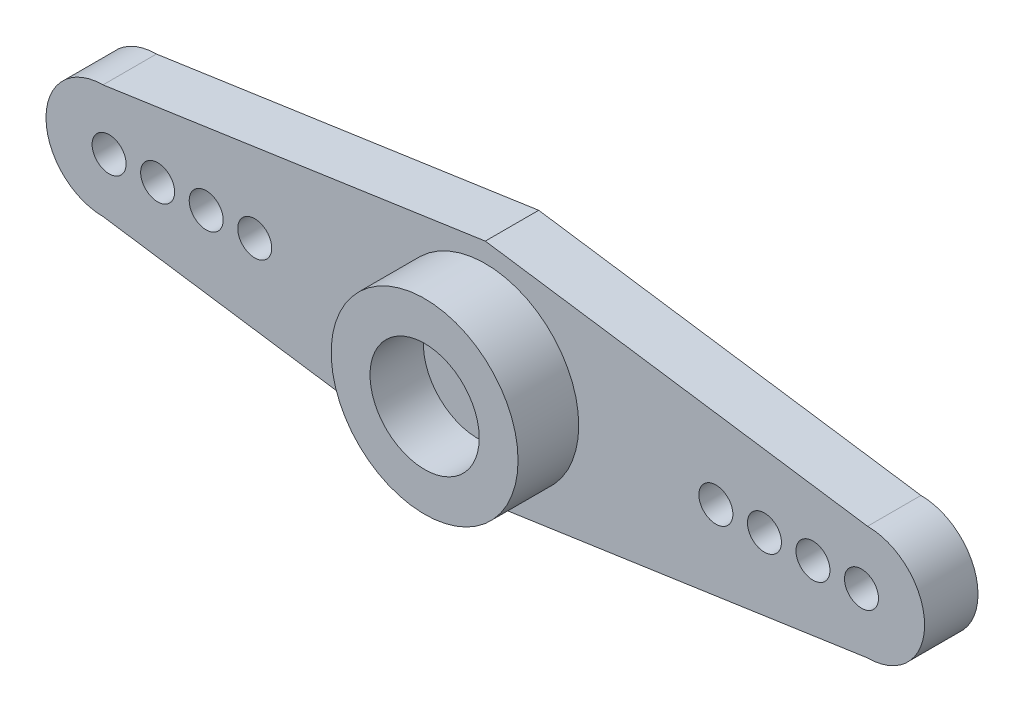
from build123d import *

# Parameters (mm, degrees)
SKETCH1_W         = 45.974
SKETCH1_H         = 11.811
EXTRUDE1_DEPTH    = 5.969
SKETCH2_OUTSIDE_W = 57.542
SKETCH2_OUTSIDE_H = 23.379
SKETCH2_OUTSIDE_R = 4.8895
EXTRUDE2_DEPTH    = 3.175
SKETCH3_R         = 2.8575
EXTRUDE3_DEPTH    = 2.794
LPATTERN1_COUNT   = 4
LPATTERN1_PITCH   = 2.54
EXTRUDE4_DEPTH    = 25.472557289


with BuildPart() as part:
    # Sketch1 → Extrude1 (new body)
    with BuildSketch(Plane.XY):
        Rectangle(SKETCH1_W, SKETCH1_H)
    extrude(amount=EXTRUDE1_DEPTH)

    # Sketch2 outside → Extrude2 (cut)
    with BuildSketch(Plane.XY.offset(5.969)):
        with Locations((0, -0.0005)):
            Rectangle(SKETCH2_OUTSIDE_W, SKETCH2_OUTSIDE_H)
        Circle(SKETCH2_OUTSIDE_R, mode=Mode.SUBTRACT)
    extrude(amount=-EXTRUDE2_DEPTH, mode=Mode.SUBTRACT)

    # Sketch3 → Extrude3 (cut)
    with BuildSketch(Plane.XY.offset(5.969)):
        Circle(SKETCH3_R)
    extrude(amount=-EXTRUDE3_DEPTH, mode=Mode.SUBTRACT)

    # Sketch5 → #50 (0.07) Diameter Hole1 (revolve, cut)
    with BuildSketch(Plane.YZ.offset(12.065)):
        Polygon((0, 0), (0, 5.61416509), (0.889, 5.08), (0.889, 0), align=None)
    f_50_0_07_diameter_hole1 = revolve(axis=Axis((12.065, 0, -6.35), (0, 0, 1)), mode=Mode.SUBTRACT)

    # LPattern1: #50 (0.07) Diameter Hole1 ×4
    with Locations(*[(i * LPATTERN1_PITCH, 0, 0) for i in range(1, LPATTERN1_COUNT)]):
        add(f_50_0_07_diameter_hole1, mode=Mode.SUBTRACT)

    # Mirror1 copy 1 sketch → Mirror1 copy 1 (revolve, cut)
    with BuildSketch(Plane(origin=(-14.605, 0, 0), x_dir=(0, 1, 0), z_dir=(-1, 0, 0))):
        Polygon((0, 0), (0, -5.61416509), (0.889, -5.08), (0.889, 0), align=None)
    revolve(axis=Axis((-14.605, 0, -6.35), (0, 0, -1)), mode=Mode.SUBTRACT)

    # Mirror1 copy 2 sketch → Mirror1 copy 2 (revolve, cut)
    with BuildSketch(Plane(origin=(-17.145, 0, 0), x_dir=(0, 1, 0), z_dir=(-1, 0, 0))):
        Polygon((0, 0), (0, -5.61416509), (0.889, -5.08), (0.889, 0), align=None)
    revolve(axis=Axis((-17.145, 0, -6.35), (0, 0, -1)), mode=Mode.SUBTRACT)

    # Mirror1 copy 3 sketch → Mirror1 copy 3 (revolve, cut)
    with BuildSketch(Plane(origin=(-19.685, 0, 0), x_dir=(0, 1, 0), z_dir=(-1, 0, 0))):
        Polygon((0, 0), (0, -5.61416509), (0.889, -5.08), (0.889, 0), align=None)
    revolve(axis=Axis((-19.685, 0, -6.35), (0, 0, -1)), mode=Mode.SUBTRACT)

    # Mirror1 copy 4 sketch → Mirror1 copy 4 (revolve, cut)
    with BuildSketch(Plane(origin=(-12.065, 0, 0), x_dir=(0, 1, 0), z_dir=(-1, 0, 0))):
        Polygon((0, 0), (0, -5.61416509), (0.889, -5.08), (0.889, 0), align=None)
    revolve(axis=Axis((-12.065, 0, -6.35), (0, 0, -1)), mode=Mode.SUBTRACT)

    # Sketch6 → Extrude4 (cut, through all)
    with BuildSketch(Plane(origin=(0, 0, 0), x_dir=(-1, 0, 0), z_dir=(0, 0, -1))):
        with BuildLine():
            Line((-61.04017999, 14.819304062), (0, 5.9055))
            Line((0, 5.9055), (20.0025, 2.9845))
            ThreePointArc((20.0025, 2.9845), (22.112860188, 2.110360188), (22.987, 0))
            ThreePointArc((22.987, 0), (22.112860188, -2.110360188), (20.0025, -2.9845))
            Line((20.0025, -2.9845), (0, -5.9055))
            Line((0, -5.9055), (-61.04017999, -14.819304062))
            Line((-61.04017999, -14.819304062), (62.335011618, -14.819304062))
            Line((62.335011618, -14.819304062), (62.335011618, 14.819304062))
            Line((62.335011618, 14.819304062), (-61.04017999, 14.819304062))
        make_face()
    extrude4 = extrude(amount=-EXTRUDE4_DEPTH, mode=Mode.SUBTRACT)

    # Mirror2: Extrude4 across plane
    add(extrude4.mirror(Plane(origin=(0, 0, 0), x_dir=(0, 0, 1), z_dir=(1, 0, 0))), mode=Mode.SUBTRACT)


solid = part.part
